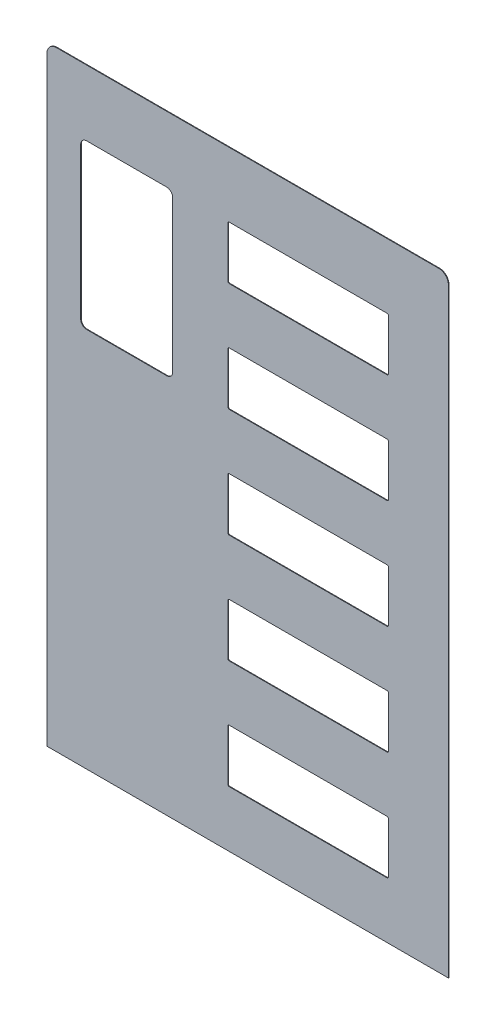
from build123d import *

# Parameters (mm, degrees)
BASE_FLANGE1_DEPTH = 1
CUT_EXTRUDE1_DEPTH = 10
CUT_EXTRUDE2_DEPTH = 10


# Sheet-metal steps are written as plain solids
with BuildPart() as part:
    # Sketch1 → Base-Flange1 (new body)
    with BuildSketch(Plane.XY):
        with BuildLine():
            Line((0, 0), (663.4, 0))
            Line((663.4, 0), (663.4, 992))
            ThreePointArc((663.4, 992), (658.801576465, 1003.101576465), (647.7, 1007.7))
            Line((647.7, 1007.7), (15.7, 1007.7))
            ThreePointArc((15.7, 1007.7), (4.598423535, 1003.101576465), (0, 992))
            Line((0, 992), (0, 0))
        make_face()
    extrude(amount=-BASE_FLANGE1_DEPTH)

    # Sketch9 → Cut-Extrude1 (cut)
    with BuildSketch(Plane.XY):
        with BuildLine():
            Line((562.2, 900.7), (301.2, 900.7))
            ThreePointArc((301.2, 900.7), (299.785786438, 900.114213562), (299.2, 898.7))
            Line((299.2, 898.7), (299.2, 814.7))
            ThreePointArc((299.2, 814.7), (299.785786438, 813.285786438), (301.2, 812.7))
            Line((301.2, 812.7), (562.2, 812.7))
            ThreePointArc((562.2, 812.7), (563.614213562, 813.285786438), (564.2, 814.7))
            Line((564.2, 814.7), (564.2, 898.7))
            ThreePointArc((564.2, 898.7), (563.614213562, 900.114213562), (562.2, 900.7))
        make_face()
        with BuildLine():
            Line((564.2, 718.7), (564.2, 634.7))
            ThreePointArc((564.2, 634.7), (563.614213562, 633.285786438), (562.2, 632.7))
            Line((562.2, 632.7), (301.2, 632.7))
            ThreePointArc((301.2, 632.7), (299.785786438, 633.285786438), (299.2, 634.7))
            Line((299.2, 634.7), (299.2, 718.7))
            ThreePointArc((299.2, 718.7), (299.785786438, 720.114213562), (301.2, 720.7))
            Line((301.2, 720.7), (562.2, 720.7))
            ThreePointArc((562.2, 720.7), (563.614213562, 720.114213562), (564.2, 718.7))
        make_face()
        with BuildLine():
            Line((564.2, 538.7), (564.2, 454.7))
            ThreePointArc((564.2, 454.7), (563.614213562, 453.285786438), (562.2, 452.7))
            Line((562.2, 452.7), (301.2, 452.7))
            ThreePointArc((301.2, 452.7), (299.785786438, 453.285786438), (299.2, 454.7))
            Line((299.2, 454.7), (299.2, 538.7))
            ThreePointArc((299.2, 538.7), (299.785786438, 540.114213562), (301.2, 540.7))
            Line((301.2, 540.7), (562.2, 540.7))
            ThreePointArc((562.2, 540.7), (563.614213562, 540.114213562), (564.2, 538.7))
        make_face()
        with BuildLine():
            Line((564.2, 358.7), (564.2, 274.7))
            ThreePointArc((564.2, 274.7), (563.614213562, 273.285786438), (562.2, 272.7))
            Line((562.2, 272.7), (301.2, 272.7))
            ThreePointArc((301.2, 272.7), (299.785786438, 273.285786438), (299.2, 274.7))
            Line((299.2, 274.7), (299.2, 358.7))
            ThreePointArc((299.2, 358.7), (299.785786438, 360.114213562), (301.2, 360.7))
            Line((301.2, 360.7), (562.2, 360.7))
            ThreePointArc((562.2, 360.7), (563.614213562, 360.114213562), (564.2, 358.7))
        make_face()
        with BuildLine():
            Line((564.2, 178.7), (564.2, 94.7))
            ThreePointArc((564.2, 94.7), (563.614213562, 93.285786438), (562.2, 92.7))
            Line((562.2, 92.7), (301.2, 92.7))
            ThreePointArc((301.2, 92.7), (299.785786438, 93.285786438), (299.2, 94.7))
            Line((299.2, 94.7), (299.2, 178.7))
            ThreePointArc((299.2, 178.7), (299.785786438, 180.114213562), (301.2, 180.7))
            Line((301.2, 180.7), (562.2, 180.7))
            ThreePointArc((562.2, 180.7), (563.614213562, 180.114213562), (564.2, 178.7))
        make_face()
    extrude(amount=-CUT_EXTRUDE1_DEPTH, mode=Mode.SUBTRACT)

    # Sketch10 → Cut-Extrude2 (cut)
    with BuildSketch(Plane.XY):
        with BuildLine():
            Line((65.7, 629.2), (197.7, 629.2))
            ThreePointArc((197.7, 629.2), (204.771067812, 632.128932188), (207.7, 639.2))
            Line((207.7, 639.2), (207.7, 889.2))
            ThreePointArc((207.7, 889.2), (204.771067812, 896.271067812), (197.7, 899.2))
            Line((197.7, 899.2), (65.7, 899.2))
            ThreePointArc((65.7, 899.2), (58.628932188, 896.271067812), (55.7, 889.2))
            Line((55.7, 889.2), (55.7, 639.2))
            ThreePointArc((55.7, 639.2), (58.628932188, 632.128932188), (65.7, 629.2))
        make_face()
    extrude(amount=-CUT_EXTRUDE2_DEPTH, mode=Mode.SUBTRACT)


solid = part.part
